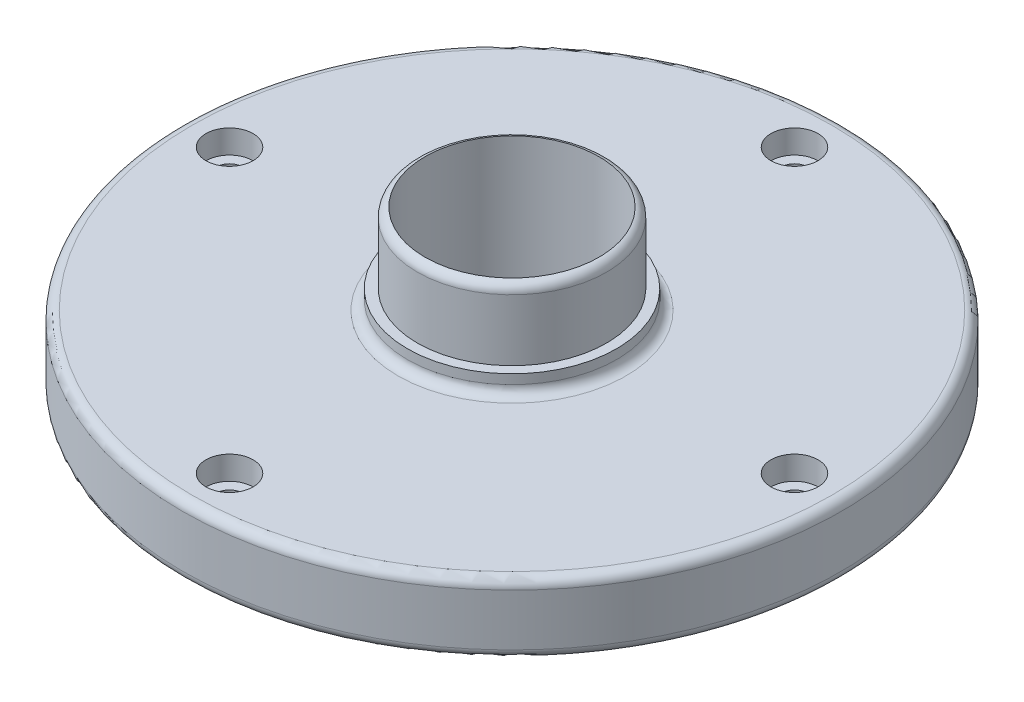
from build123d import *

# Parameters (mm, degrees)
SKETCH2_R                      = 70
BOSS_EXTRUDE1_DEPTH            = 15
CBORE_FOR_M5_SHCS1_D           = 5.5
CBORE_FOR_M5_SHCS1_CBORE_D     = 10
CBORE_FOR_M5_SHCS1_CBORE_DEPTH = 5
SKETCH23_R                     = 20.1
SKETCH23_R_2                   = 18.5
BOSS_EXTRUDE2_DEPTH            = 19
SKETCH24_R                     = 18.5
CUT_EXTRUDE4_DEPTH             = 101.801785698
SKETCH25_R                     = 22.2
SKETCH25_R_2                   = 20.1
BOSS_EXTRUDE3_DEPTH            = 4
FILLET2_R                      = 2


with BuildPart() as part:
    # Sketch2 → Boss-Extrude1 (new body)
    with BuildSketch(Plane(origin=(0, 0, 0), x_dir=(1, 0, 0), z_dir=(0, 1, 0))):
        with Locations(Location((0, 0, 0), (0, 0, 270))):
            Circle(SKETCH2_R)
    extrude(amount=BOSS_EXTRUDE1_DEPTH)

    # CBORE for M5 SHCS1 (through all)
    with Locations(Plane(origin=(0, 15, 0), x_dir=(1, 0, 0), z_dir=(0, 1, 0))):
        with Locations((0, 60), (60, 0), (-60, 0), (0, -60)):
            CounterBoreHole(CBORE_FOR_M5_SHCS1_D / 2, CBORE_FOR_M5_SHCS1_CBORE_D / 2, CBORE_FOR_M5_SHCS1_CBORE_DEPTH)

    # Sketch23 → Boss-Extrude2 (add)
    with BuildSketch(Plane(origin=(0, 15, 0), x_dir=(1, 0, 0), z_dir=(0, 1, 0))):
        with Locations(Location((0, 0, 0), (0, 0, 270))):
            Circle(SKETCH23_R)
        with Locations(Location((0, 0, 0), (0, 0, 270))):
            Circle(SKETCH23_R_2, mode=Mode.SUBTRACT)
    extrude(amount=BOSS_EXTRUDE2_DEPTH)

    # Sketch24 → Cut-Extrude4 (cut, through all)
    with BuildSketch(Plane(origin=(0, 15, 0), x_dir=(1, 0, 0), z_dir=(0, 1, 0))):
        with Locations(Location((0, 0, 0), (0, 0, 270))):
            Circle(SKETCH24_R)
    extrude(amount=-CUT_EXTRUDE4_DEPTH, mode=Mode.SUBTRACT)

    # Sketch25 → Boss-Extrude3 (add)
    with BuildSketch(Plane(origin=(0, 15, 0), x_dir=(1, 0, 0), z_dir=(0, 1, 0))):
        with Locations(Location((0, 0, 0), (0, 0, 270))):
            Circle(SKETCH25_R)
        with Locations(Location((0, 0, 0), (0, 0, 270))):
            Circle(SKETCH25_R_2, mode=Mode.SUBTRACT)
    extrude(amount=BOSS_EXTRUDE3_DEPTH)

    # Fillet2
    # the kernel refuses this fillet: 2 mm, written as the material it adds along each edge
    with BuildSketch(Plane(origin=(0, 15, 0), x_dir=(0, 0, 1), z_dir=(-1, 0, 0))) as fillet2_piece_1:
        with BuildLine():
            CenterArc((22.2 + FILLET2_R, FILLET2_R), FILLET2_R, 180, 90)
            Line((22.2, FILLET2_R), (22.2, 0))
            Line((22.2, 0), (22.2 + FILLET2_R, 0))
        make_face()
    revolve(axis=Axis((0, 15, 0), (0, 1, 0)))
    # the kernel refuses this fillet: 2 mm, written as the material it takes off along each edge
    with BuildSketch(Plane(origin=(0, 0, 0), x_dir=(0, 0, 1), z_dir=(-1, 0, 0))) as fillet2_2_piece_1:
        with BuildLine():
            CenterArc((70 - FILLET2_R, FILLET2_R), FILLET2_R, 270, 90)
            Line((70 - FILLET2_R, 0), (70, 0))
            Line((70, 0), (70, FILLET2_R))
        make_face()
    revolve(axis=Axis((0, 0, 0), (0, 1, 0)), mode=Mode.SUBTRACT)
    with BuildSketch(Plane(origin=(0, 34, 0), x_dir=(0, 0, 1), z_dir=(-1, 0, 0))) as fillet2_2_piece_2:
        with BuildLine():
            CenterArc((18.1, -1.959591794), FILLET2_R, 0, 78.463040967)
            Line((20.1, -1.959591794), (20.1, 0))
            Line((20.1, 0), (18.5, 0))
        make_face()
    revolve(axis=Axis((0, 34, 0), (0, 1, 0)), mode=Mode.SUBTRACT)
    with BuildSketch(Plane(origin=(0, 15, 0), x_dir=(0, 0, 1), z_dir=(-1, 0, 0))) as fillet2_2_piece_3:
        with BuildLine():
            CenterArc((70 - FILLET2_R, -FILLET2_R), FILLET2_R, 0, 90)
            Line((70 - FILLET2_R, 0), (70, 0))
            Line((70, 0), (70, -FILLET2_R))
        make_face()
    revolve(axis=Axis((0, 15, 0), (0, 1, 0)), mode=Mode.SUBTRACT)


solid = part.part
